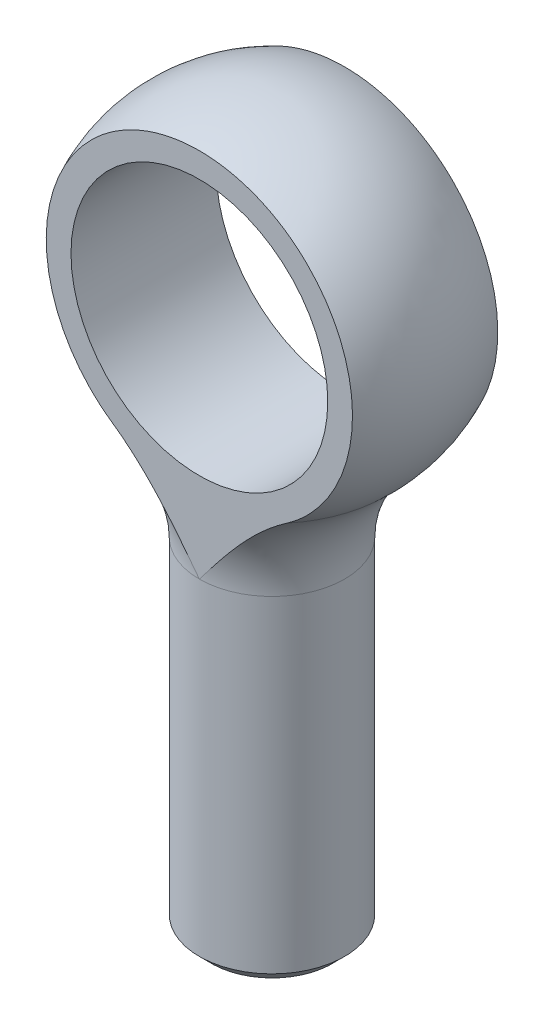
from build123d import *

# Parameters (mm, degrees)
SKETCH1_W               = 9.525
SKETCH1_H               = 44.45
CHAMFER2_SIZE           = 1.5875
CUT_EXTRUDE1_DEPTH      = 60.737268518
CUT_EXTRUDE1_DEPTH_BACK = 60.737268518
SKETCH5_W               = 12.7
SKETCH5_H               = 50.8
CUT_EXTRUDE2_DEPTH      = 57.261143358
CUT_EXTRUDE2_DEPTH_BACK = 57.261143358
SKETCH6_R               = 16.8354375
CUT_EXTRUDE3_DEPTH      = 58.900240514
CUT_EXTRUDE3_DEPTH_BACK = 58.900240514
SKETCH8_W               = 11.1125
SKETCH8_H               = 50.8
CUT_EXTRUDE4_DEPTH      = 58.900240514
CUT_EXTRUDE4_DEPTH_BACK = 58.900240514
SKETCH10_R              = 9.525
CHAMFER1_SIZE           = 0.9525


with BuildPart() as part:
    # Sketch1 → Revolve1 (revolve)
    with BuildSketch(Plane.XY):
        with Locations((4.7625, -22.225)):
            Rectangle(SKETCH1_W, SKETCH1_H)
    revolve(axis=Axis((0, 50.8, 0), (0, -1, 0)))

    # Chamfer2
    chamfer2_edges = [part.edges().sort_by_distance(p)[0] for p in [
        (-9.525, -44.45, 0),
    ]]
    chamfer(chamfer2_edges, length=CHAMFER2_SIZE)

    # Sketch4 → Revolve2 (revolve)
    with BuildSketch(Plane.XY):
        with BuildLine():
            Line((9.525, 0), (0, 0))
            Line((0, 0), (0, 50.8))
            ThreePointArc((0, 50.8), (20.743606098, 36.553310038), (14.893041237, 12.078092784))
            ThreePointArc((14.893041237, 12.078092784), (10.927447707, 6.608634352), (9.525, 0))
        make_face()
    revolve(axis=Axis((0, 50.8, 0), (0, 1, 0)))

    # Sketch5 → Cut-Extrude1 (cut, two sides: drawn at the far end of the back side and taken through both)
    with BuildSketch(Plane(origin=(0, 0, 0), x_dir=(0, 0, -1), z_dir=(1, 0, 0)).offset(-CUT_EXTRUDE1_DEPTH_BACK)):
        with Locations((15.875, 25.4)):
            Rectangle(SKETCH5_W, SKETCH5_H)
        with Locations((-15.875, 25.4)):
            Rectangle(SKETCH5_W, SKETCH5_H)
    extrude(amount=CUT_EXTRUDE1_DEPTH + CUT_EXTRUDE1_DEPTH_BACK, mode=Mode.SUBTRACT)

    # Sketch6 → Cut-Extrude2 (cut, two sides: drawn at the far end of the back side and taken through both)
    with BuildSketch(Plane.XY.offset(-CUT_EXTRUDE2_DEPTH_BACK)):
        with Locations((0, 28.575)):
            Circle(SKETCH6_R)
    extrude(amount=CUT_EXTRUDE2_DEPTH + CUT_EXTRUDE2_DEPTH_BACK, mode=Mode.SUBTRACT)


with BuildPart() as body_2:
    # Sketch7 → Revolve3 (revolve)
    with BuildSketch(Plane.XY):
        with BuildLine():
            Line((0, 45.24375), (0, 11.90625))
            ThreePointArc((0, 11.90625), (16.66875, 28.575), (0, 45.24375))
        make_face()
    revolve(axis=Axis((0, 0, 0), (0, 1, 0)))

    # Sketch8 → Cut-Extrude3 (cut, two sides: drawn at the far end of the back side and taken through both)
    with BuildSketch(Plane(origin=(0, 0, 0), x_dir=(0, 0, -1), z_dir=(1, 0, 0)).offset(-CUT_EXTRUDE3_DEPTH_BACK)):
        with Locations((-16.66875, 25.4)):
            Rectangle(SKETCH8_W, SKETCH8_H)
        with Locations((16.66875, 25.4)):
            Rectangle(SKETCH8_W, SKETCH8_H)
    extrude(amount=CUT_EXTRUDE3_DEPTH + CUT_EXTRUDE3_DEPTH_BACK, mode=Mode.SUBTRACT)

    # Sketch10 → Cut-Extrude4 (cut, two sides: drawn at the far end of the back side and taken through both)
    with BuildSketch(Plane.XY.offset(-CUT_EXTRUDE4_DEPTH_BACK)):
        with Locations((0, 28.575)):
            Circle(SKETCH10_R)
    extrude(amount=CUT_EXTRUDE4_DEPTH + CUT_EXTRUDE4_DEPTH_BACK, mode=Mode.SUBTRACT)

    # Chamfer1
    chamfer1_edges = [body_2.edges().sort_by_distance(p)[0] for p in [
        (-9.525, 28.575, -11.1125),
        (-9.525, 28.575, 11.1125),
    ]]
    chamfer(chamfer1_edges, length=CHAMFER1_SIZE)


solid = part.part
